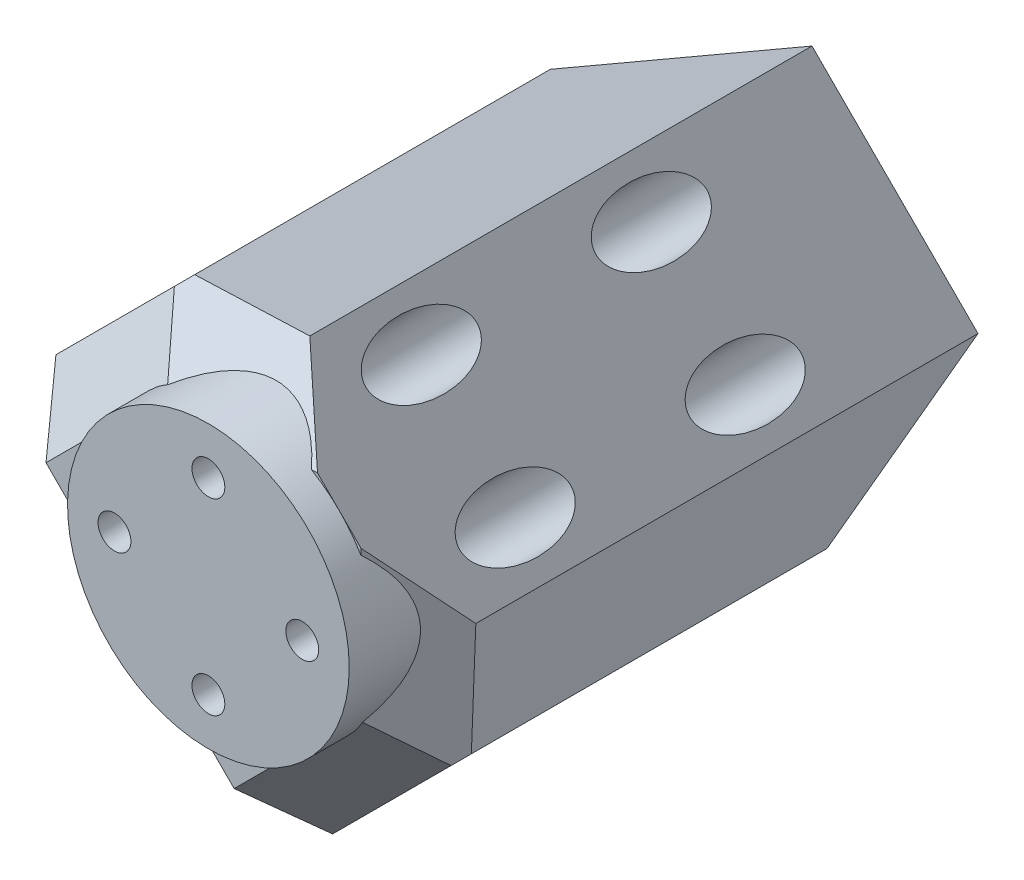
from build123d import *

# Parameters (mm, degrees)
SKETCH1_R           = 9
SKETCH1_R_2         = 1.05
BOSS_EXTRUDE1_DEPTH = 2
CHAMFER1_SIZE       = 4
CUT_EXTRUDE3_START  = -53
SKETCH6_R           = 1.05
CUT_EXTRUDE3_DEPTH  = 53
CUT_EXTRUDE4_START  = -2
SKETCH5_R           = 2.05
CUT_EXTRUDE4_DEPTH  = 53
CHAMFER2_SIZE       = 5
CHAMFER3_SIZE       = 5
CHAMFER3_SIZE_2     = 4.05977785
SKETCH8_W           = 40.645388092
SKETCH8_H           = 21.779978949
CUT_EXTRUDE5_DEPTH  = 34


with BuildPart() as part:
    # Sketch1 → Boss-Extrude1 (new body)
    with BuildSketch(Plane.XY):
        Circle(SKETCH1_R)
        with Locations((0, 6)):
            Circle(SKETCH1_R_2, mode=Mode.SUBTRACT)
        with Locations((-6, 0)):
            Circle(SKETCH1_R_2, mode=Mode.SUBTRACT)
        with Locations((0, -6)):
            Circle(SKETCH1_R_2, mode=Mode.SUBTRACT)
        with Locations((6, 0)):
            Circle(SKETCH1_R_2, mode=Mode.SUBTRACT)
    extrude(amount=BOSS_EXTRUDE1_DEPTH)

    # Sketch3 → Loft1 section 0
    with BuildSketch(Plane(origin=(0, 0, -50), x_dir=(-1, 0, 0), z_dir=(0, 0, -1))):
        with BuildLine():
            Line((-0.707106781, -16.970562748), (16.970562748, 0.707106781))
            Line((16.970562748, 0.707106781), (21.920310217, -4.242640687))
            Line((21.920310217, -4.242640687), (4.242640687, -21.920310217))
            Line((4.242640687, -21.920310217), (-0.707106781, -16.970562748))
        make_face()
    # Sketch2 → Loft1 section 1
    with BuildSketch(Plane(origin=(0, 0, 0), x_dir=(-1, 0, 0), z_dir=(0, 0, -1))):
        with BuildLine():
            Line((-15.202795796, -2.474873734), (2.474873734, 15.202795796))
            Line((2.474873734, 15.202795796), (15.202795796, 2.474873734))
            Line((15.202795796, 2.474873734), (-2.474873734, -15.202795796))
            Line((-2.474873734, -15.202795796), (-15.202795796, -2.474873734))
        make_face()
    loft()

    # Chamfer1
    # the kernel refuses this chamfer: 4 mm, written as the material it takes off along each edge
    with BuildSketch(Plane(origin=(-4.798944185, -22.476613715, 0), x_dir=(-0.7068394360706721, 0.7068394360706747, 0.027495876610586344), z_dir=(0.7071067811865488, 0.7071067811865462, 0))) as chamfer1_piece_1_section:
        Polygon((CHAMFER1_SIZE * 0.999621916911, -CHAMFER1_SIZE * 0.0274958766106), (-CHAMFER1_SIZE * 0.0274958766106, -CHAMFER1_SIZE * 0.999621916911), (0, 0), align=None)
    chamfer1_piece_1 = extrude(amount=38.573463904, mode=Mode.PRIVATE)
    chamfer1_piece_1 = chamfer1_piece_1 - Plane(origin=(0, 0, -1.322334287), x_dir=(1, 0, 0), z_dir=(0, 0, -1)) * Cylinder(9, 94, mode=Mode.PRIVATE)
    add(chamfer1_piece_1, mode=Mode.SUBTRACT)
    with BuildSketch(Plane(origin=(4.798944185, 22.476613715, 0), x_dir=(0.7068394360706721, -0.7068394360706749, 0.027495876610586396), z_dir=(-0.7071067811865489, -0.7071067811865461, 0))) as chamfer1_piece_2_section:
        Polygon((CHAMFER1_SIZE * 0.999621916911, -CHAMFER1_SIZE * 0.0274958766106), (-CHAMFER1_SIZE * 0.0274958766106, -CHAMFER1_SIZE * 0.999621916911), (0, 0), align=None)
    chamfer1_piece_2 = extrude(amount=38.573463904, mode=Mode.PRIVATE)
    chamfer1_piece_2 = chamfer1_piece_2 - Plane(origin=(0, 0, -1.322334287), x_dir=(1, 0, 0), z_dir=(0, 0, -1)) * Cylinder(9, 94, mode=Mode.PRIVATE)
    add(chamfer1_piece_2, mode=Mode.SUBTRACT)

    # Sketch6 → Cut-Extrude3 (cut)
    with BuildSketch(Plane.XY.offset(2).offset(CUT_EXTRUDE3_START)):
        with Locations(Location((0, -6, 0), (0, 0, 45))):
            Circle(SKETCH6_R)
        with Locations(Location((6, 0, 0), (0, 0, 45))):
            Circle(SKETCH6_R)
        with Locations(Location((0, 6, 0), (0, 0, 45))):
            Circle(SKETCH6_R)
        with Locations(Location((-6, 0, 0), (0, 0, 45))):
            Circle(SKETCH6_R)
    extrude(amount=CUT_EXTRUDE3_DEPTH, mode=Mode.SUBTRACT)

    # Sketch5 → Cut-Extrude4 (cut)
    with BuildSketch(Plane.XY.offset(2).offset(CUT_EXTRUDE4_START)):
        with Locations(Location((-6, 0, 0), (0, 0, 45))):
            Circle(SKETCH5_R)
        with Locations(Location((0, -6, 0), (0, 0, 45))):
            Circle(SKETCH5_R)
        with Locations(Location((0, 6, 0), (0, 0, 45))):
            Circle(SKETCH5_R)
        with Locations(Location((6, 0, 0), (0, 0, 45))):
            Circle(SKETCH5_R)
    extrude(amount=-CUT_EXTRUDE4_DEPTH, mode=Mode.SUBTRACT)

    # Chamfer2
    chamfer2_edges = [part.edges().sort_by_distance(p)[0] for p in [
        (-10.302545802, 7.375123728, -27),
        (7.375123728, -10.302545802, -27),
    ]]
    chamfer(chamfer2_edges, length=CHAMFER2_SIZE)

    # Chamfer3
    # the kernel refuses this chamfer: 5, 4.05977785 mm, written as the material it takes off along each edge
    with BuildSketch(Plane(origin=(13.909394742, 12.166115274, 0), x_dir=(0.009375164320641791, -0.2414717461398742, -0.9703625621952453), z_dir=(-0.9992471568778876, -0.03879586925767199, 0))) as chamfer3_piece_1_section:
        Polygon((CHAMFER3_SIZE * 0.999621916911, CHAMFER3_SIZE * 0.0274958766106), (CHAMFER3_SIZE_2 * 0.241653673437, CHAMFER3_SIZE_2 * 0.970362562158), (0, 0), align=None)
    chamfer3_piece_1 = extrude(amount=27.189276823, mode=Mode.PRIVATE)
    chamfer3_piece_1 = chamfer3_piece_1 - Plane(origin=(0, 0, -1.642174888), x_dir=(1, 0, 0), z_dir=(0, 0, -1)) * Cylinder(9, 75, mode=Mode.PRIVATE)
    add(chamfer3_piece_1, mode=Mode.SUBTRACT)
    with BuildSketch(Plane(origin=(12.166115274, 13.909394742, 0), x_dir=(-0.2414717461398332, 0.009375164320638266, -0.9703625621952554), z_dir=(-0.03879586925766401, -0.9992471568778879, 0))) as chamfer3_piece_2_section:
        Polygon((CHAMFER3_SIZE * 0.999621916911, -CHAMFER3_SIZE * 0.0274958766106), (CHAMFER3_SIZE_2 * 0.241653673437, -CHAMFER3_SIZE_2 * 0.970362562158), (0, 0), align=None)
    chamfer3_piece_2 = extrude(amount=27.189276823, mode=Mode.PRIVATE)
    chamfer3_piece_2 = chamfer3_piece_2 - Plane(origin=(0, 0, -1.642174892), x_dir=(1, 0, 0), z_dir=(0, 0, -1)) * Cylinder(9, 75, mode=Mode.PRIVATE)
    add(chamfer3_piece_2, mode=Mode.SUBTRACT)

    # Sketch8 → Cut-Extrude5 (cut)
    with BuildSketch(Plane(origin=(-8.838834765, 8.838834765, 0), x_dir=(0, 0, 1), z_dir=(-0.7071067811865461, 0.7071067811865489, 0))):
        with Locations((-29.677305954, -22.389989475)):
            Rectangle(SKETCH8_W, SKETCH8_H)
    extrude(amount=-CUT_EXTRUDE5_DEPTH, mode=Mode.SUBTRACT)


solid = part.part
